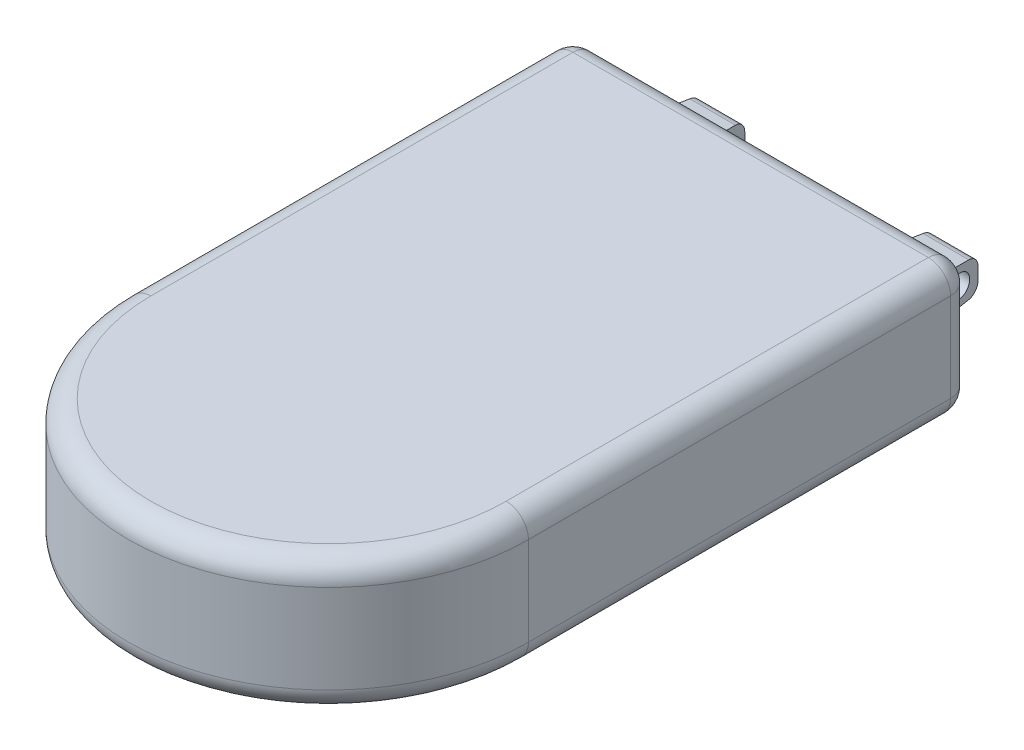
from build123d import *

# Parameters (mm, degrees)
BOSS_EXTRUDE1_DEPTH           = 152.4
FILLET1_R                     = 25.4
BOSS_EXTRUDE2_DEPTH           = 50.8
BOSS_EXTRUDE3_DEPTH           = 25.4
FILLET2_R                     = 25.4
SKETCH5_W                     = 63.5
SKETCH5_H                     = 50.8
BOSS_EXTRUDE4_DEPTH           = 76.2
BOSS_EXTRUDE4_DRAFT           = 5
BOSS_EXTRUDE4_PROFILE_2_DEPTH = 76.2
BOSS_EXTRUDE4_PROFILE_2_DRAFT = 5
FILLET3_R                     = 12.7
SKETCH7_RX                    = 12.7
SKETCH7_RY                    = 12.651672666
CUT_EXTRUDE2_DEPTH            = 1182.416868754
SCALE1_SCALE                  = 0.75


with BuildPart() as part:
    # Sketch1 → Boss-Extrude1 (new body)
    with BuildSketch(Plane(origin=(0, 0, 0), x_dir=(1, 0, 0), z_dir=(0, 1, 0))):
        with BuildLine():
            Line((228.6, -342.051110312), (-228.6, -342.051110312))
            Line((-228.6, -342.051110312), (-228.6, -850.051110312))
            ThreePointArc((-228.6, -850.051110312), (0, -1078.651110312), (228.6, -850.051110312))
            Line((228.6, -850.051110312), (228.6, -342.051110312))
        make_face()
    extrude(amount=BOSS_EXTRUDE1_DEPTH)

    # Fillet1
    fillet1_edges = [part.edges().sort_by_distance(p)[0] for p in [
        (-228.6, 152.4, 596.051110312),
        (0, 152.4, 1078.651110312),
        (228.6, 152.4, 596.051110312),
        (0, 152.4, 342.051110312),
        (228.6, 0, 596.051110312),
        (0, 0, 1078.651110312),
        (-228.6, 0, 596.051110312),
        (0, 0, 342.051110312),
        (228.6, 76.2, 342.051110312),
        (-228.6, 76.2, 342.051110312),
    ]]
    fillet(fillet1_edges, radius=FILLET1_R)

    # Sketch3 → Boss-Extrude2 (add)
    with BuildSketch(Plane.XZ):
        with BuildLine():
            Line((-133.35, 850.051110312), (-133.35, 367.451110312))
            Line((-133.35, 367.451110312), (-114.3, 367.451110312))
            Line((-114.3, 367.451110312), (-114.3, 850.051110312))
            ThreePointArc((-114.3, 850.051110312), (0, 964.351110312), (114.3, 850.051110312))
            Line((114.3, 850.051110312), (114.3, 367.451110312))
            Line((114.3, 367.451110312), (133.35, 367.451110312))
            Line((133.35, 367.451110312), (133.35, 850.051110312))
            ThreePointArc((133.35, 850.051110312), (0, 983.401110312), (-133.35, 850.051110312))
        make_face()
    extrude(amount=BOSS_EXTRUDE2_DEPTH)

    # Sketch4 → Boss-Extrude3 (add)
    with BuildSketch(Plane.XZ):
        with BuildLine():
            Line((-114.3, 850.051110312), (-114.3, 367.451110312))
            Line((-114.3, 367.451110312), (114.3, 367.451110312))
            Line((114.3, 367.451110312), (114.3, 850.051110312))
            ThreePointArc((114.3, 850.051110312), (0, 964.351110312), (-114.3, 850.051110312))
        make_face()
    extrude(amount=BOSS_EXTRUDE3_DEPTH)

    # Fillet2
    fillet2_edges = [part.edges().sort_by_distance(p)[0] for p in [
        (123.825, -50.8, 367.451110312),
        (-123.825, -50.8, 367.451110312),
        (0, -25.4, 367.451110312),
    ]]
    fillet(fillet2_edges, radius=FILLET2_R - 0.0001)  # a hair under: the kernel refuses the full size


with BuildPart() as boss_extrude4_tool:
    # Sketch5 → Boss-Extrude4 (with draft: the straight prism first)
    with BuildSketch(Plane(origin=(0, 0, 342.051110312), x_dir=(-1, 0, 0), z_dir=(0, 0, -1))):
        with Locations((133.35, 63.5)):
            Rectangle(SKETCH5_W, SKETCH5_H)
    extrude(amount=BOSS_EXTRUDE4_DEPTH)
    # Boss-Extrude4: the draft: its side faces are tilted about the plane it starts from
    boss_extrude4_sides = [boss_extrude4_tool.faces().sort_by_distance(p)[0] for p in [
        (-101.6, 63.5, 303.951110312),
        (-133.35, 38.1, 303.951110312),
        (-165.1, 63.5, 303.951110312),
        (-133.35, 88.9, 303.951110312),
    ]]
    draft(boss_extrude4_sides, Plane(origin=(0, 0, 342.051110312), x_dir=(-1, 0, 0), z_dir=(0, 0, -1)), BOSS_EXTRUDE4_DRAFT)


with BuildPart() as part_1:
    add(part.part)

    # Boss-Extrude4: add boss_extrude4_tool
    add(boss_extrude4_tool.part)


with BuildPart() as boss_extrude4_profile_2_tool:
    # Sketch5 → Boss-Extrude4 profile 2 (with draft: the straight prism first)
    with BuildSketch(Plane(origin=(0, 0, 342.051110312), x_dir=(-1, 0, 0), z_dir=(0, 0, -1))):
        with Locations((-133.35, 63.5)):
            Rectangle(SKETCH5_W, SKETCH5_H)
    extrude(amount=BOSS_EXTRUDE4_PROFILE_2_DEPTH)
    # Boss-Extrude4 profile 2: the draft: its side faces are tilted about the plane it starts from
    boss_extrude4_profile_2_sides = [boss_extrude4_profile_2_tool.faces().sort_by_distance(p)[0] for p in [
        (101.6, 63.5, 303.951110312),
        (133.35, 88.9, 303.951110312),
        (165.1, 63.5, 303.951110312),
        (133.35, 38.1, 303.951110312),
    ]]
    draft(boss_extrude4_profile_2_sides, Plane(origin=(0, 0, 342.051110312), x_dir=(-1, 0, 0), z_dir=(0, 0, -1)), BOSS_EXTRUDE4_PROFILE_2_DRAFT)


with BuildPart() as part_2:
    add(part_1.part)

    # Boss-Extrude4 profile 2: add boss_extrude4_profile_2_tool
    add(boss_extrude4_profile_2_tool.part)

    # Fillet3
    fillet3_edges = [part_2.edges().sort_by_distance(p)[0] for p in [
        (133.35, 82.233363839, 265.851110312),
        (133.35, 44.766636161, 265.851110312),
        (-133.35, 44.766636161, 265.851110312),
        (-133.35, 82.233363839, 265.851110312),
    ]]
    fillet(fillet3_edges, radius=FILLET3_R)

    # Sketch7 → Cut-Extrude2 (cut, through all)
    with BuildSketch(Plane.ZY.offset(228.6)):
        with Locations(Location((288.946136063, 63.5), (0, 0, 90))):
            Ellipse(SKETCH7_RX, SKETCH7_RY)
    extrude(amount=-CUT_EXTRUDE2_DEPTH, mode=Mode.SUBTRACT)


with BuildPart() as part_3:
    # Scale1: scaled about (1.9e-07, 67.979865598, 684.18432939)
    add(part_2.part.scale(SCALE1_SCALE).moved(Location((4.8e-08, 16.9949664, 171.046082348))))


solid = part_3.part
